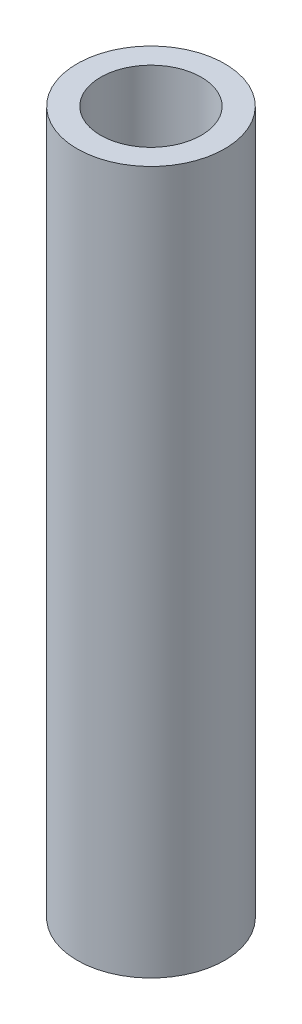
from build123d import *

# Parameters (mm, degrees)
SKETCH1_R           = 40
SKETCH1_R_2         = 27.3
BOSS_EXTRUDE1_DEPTH = 381


with BuildPart() as part:
    # Sketch1 → Boss-Extrude1 (new body)
    with BuildSketch(Plane(origin=(0, 0, 0), x_dir=(1, 0, 0), z_dir=(0, 1, 0))):
        Circle(SKETCH1_R)
        Circle(SKETCH1_R_2, mode=Mode.SUBTRACT)
    extrude(amount=BOSS_EXTRUDE1_DEPTH)


solid = part.part
